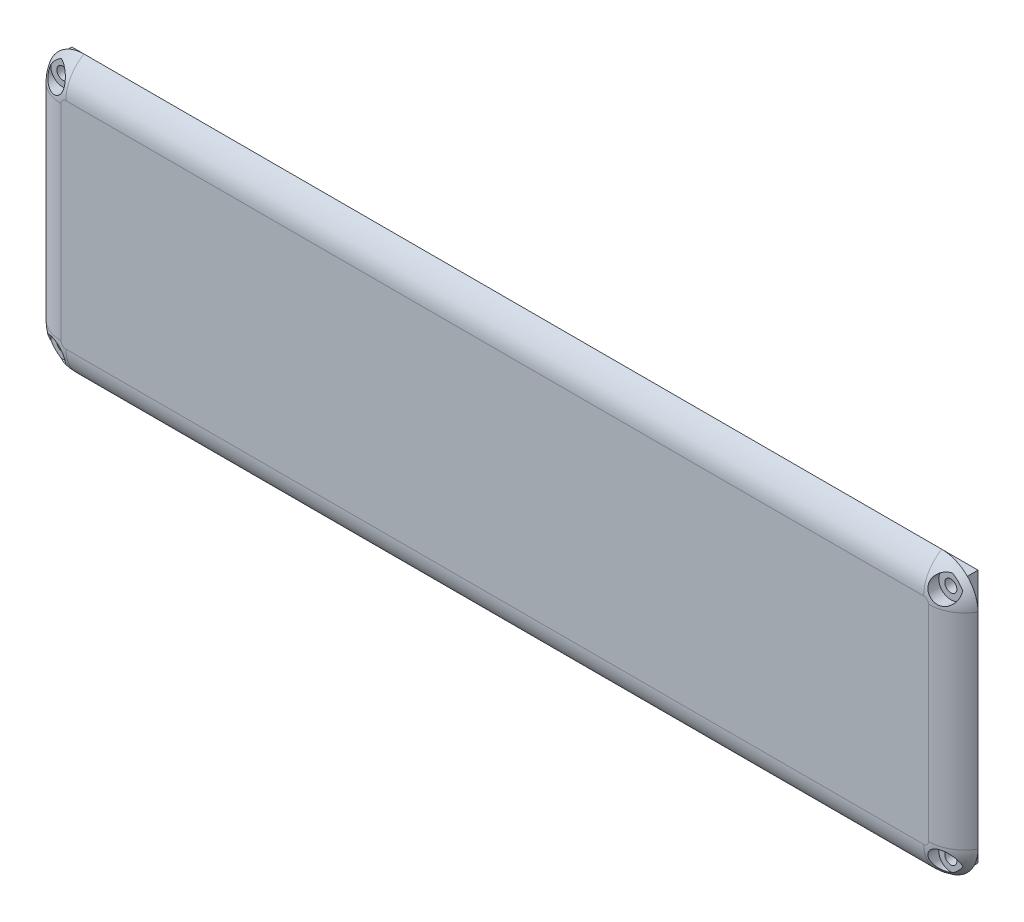
from build123d import *

# Parameters (mm, degrees)
SKETCH_1_W          = 150
SKETCH_1_H          = 42
EXTRUDE_1_DEPTH     = 2
SKETCH_2_R          = 1
CUT_EXTRUDE_1_DEPTH = 2
SKETCH_3_W          = 154
SKETCH_3_H          = 46
EXTRUDE_2_DEPTH     = 3
FILLET_2_R          = 6
FILLET_3_R          = 6
CUT_EXTRUDE_START   = 2
SKETCH_2_2_R        = 1
CUT_EXTRUDE_2_DEPTH = 2
SKETCH_4_R          = 2
CUT_EXTRUDE_3_DEPTH = 2


with BuildPart() as part:
    # 草图1 → 凸台-拉伸1 (new body)
    with BuildSketch(Plane.XY):
        with Locations((0.451807229, -22.248953788)):
            Rectangle(SKETCH_1_W, SKETCH_1_H)
    extrude(amount=EXTRUDE_1_DEPTH)

    # 草图2 → 切除-拉伸1 (cut)
    with BuildSketch(Plane.XY.offset(2)):
        with Locations((73.951807229, -41.748953788)):
            Circle(SKETCH_2_R)
        with Locations(Location((73.951807229, -2.748953788, 0), (0, 0, 180))):
            Circle(SKETCH_2_R)
        with Locations(Location((-73.048192771, -41.748953788, 0), (0, 0, 180))):
            Circle(SKETCH_2_R)
        with Locations((-73.048192771, -2.748953788)):
            Circle(SKETCH_2_R)
    extrude(amount=-CUT_EXTRUDE_1_DEPTH, mode=Mode.SUBTRACT)

    # 草图3 → 凸台-拉伸2 (add)
    with BuildSketch(Plane.XY.offset(2)):
        with Locations((0.451807229, -22.248953788)):
            Rectangle(SKETCH_3_W, SKETCH_3_H)
    extrude(amount=EXTRUDE_2_DEPTH)

    # 圆角2
    fillet_2_edges = [part.edges().sort_by_distance(p)[0] for p in [
        (-76.548192771, 0.751046212, 3.5),
        (-76.548192771, -45.248953788, 3.5),
        (77.451807229, -45.248953788, 3.5),
        (77.451807229, 0.751046212, 3.5),
    ]]
    fillet(fillet_2_edges, radius=FILLET_2_R)

    # 圆角3
    # the kernel refuses this fillet: 6 mm, written as the material it takes off along each edge
    with BuildSketch(Plane(origin=(71.451807229, -5.248953788, 5), x_dir=(0, 1, 0), z_dir=(-1, 0, 0))) as fillet_3_piece_1:
        with BuildLine():
            CenterArc((0.803847577, 6), FILLET_3_R, 270, 60)
            Line((0.803847577, 0), (0.803847577, -0.12))
            Line((0.803847577, -0.12), (6, -0.12))
            Line((6, -0.12), (6.12, 0))
            ThreePointArc((6.12, 0), (6.12, 1.5), (6.103923048, 2.94))
            Line((6.103923048, 2.94), (6, 3))
        make_face()
    revolve(axis=Axis((71.451807229, -5.248953788, 5), (0, 0, -1)), revolution_arc=90, mode=Mode.SUBTRACT)
    with BuildSketch(Plane(origin=(77.451807229, -5.248953788, 5), x_dir=(-1, 0, 0), z_dir=(0, -1, 0)), Plane(origin=(-76.548192771, -39.248953788, 5), x_dir=(1, 0, 0), z_dir=(0, 1, 0))) as fillet_3_piece_2:
        with BuildLine():
            CenterArc((5.196152423, 6), FILLET_3_R, 210, 60)
            Line((0, 3), (-0.103923048, 2.94))
            ThreePointArc((-0.103923048, 2.94), (-0.12, 1.5), (-0.12, 0))
            Line((-0.12, 0), (0, -0.12))
            Line((0, -0.12), (5.196152423, -0.12))
            Line((5.196152423, -0.12), (5.196152423, 0))
        make_face()
    extrude(amount=34, mode=Mode.SUBTRACT)
    with BuildSketch(Plane(origin=(71.451807229, -39.248953788, 5), x_dir=(1, 0, 0), z_dir=(0, 1, 0))) as fillet_3_piece_3:
        with BuildLine():
            CenterArc((0.803847577, 6), FILLET_3_R, 270, 60)
            Line((6, 3), (6.103923048, 2.94))
            ThreePointArc((6.103923048, 2.94), (6.12, 1.5), (6.12, 0))
            Line((6.12, 0), (6, -0.12))
            Line((6, -0.12), (0.803847577, -0.12))
            Line((0.803847577, -0.12), (0.803847577, 0))
        make_face()
    revolve(axis=Axis((71.451807229, -39.248953788, 5), (0, 0, -1)), revolution_arc=90, mode=Mode.SUBTRACT)
    with BuildSketch(Plane(origin=(71.451807229, -45.248953788, 5), x_dir=(0, 1, 0), z_dir=(-1, 0, 0))) as fillet_3_piece_4:
        with BuildLine():
            CenterArc((5.196152423, 6), FILLET_3_R, 210, 60)
            Line((0, 3), (-0.103923048, 2.94))
            ThreePointArc((-0.103923048, 2.94), (-0.12, 1.5), (-0.12, 0))
            Line((-0.12, 0), (0, -0.12))
            Line((0, -0.12), (5.196152423, -0.12))
            Line((5.196152423, -0.12), (5.196152423, 0))
        make_face()
    extrude(amount=142, mode=Mode.SUBTRACT)
    with BuildSketch(Plane(origin=(-70.548192771, -39.248953788, 5), x_dir=(-1, 0, 0), z_dir=(0, 1, 0))) as fillet_3_piece_5:
        with BuildLine():
            CenterArc((0.803847577, -6), FILLET_3_R, 30, 60)
            Line((6, -3), (6.103923048, -2.94))
            ThreePointArc((6.103923048, -2.94), (6.12, -1.5), (6.12, 0))
            Line((6.12, 0), (6, 0.12))
            Line((6, 0.12), (0.803847577, 0.12))
            Line((0.803847577, 0.12), (0.803847577, 0))
        make_face()
    revolve(axis=Axis((-70.548192771, -39.248953788, 5), (0, 0, 1)), revolution_arc=90, mode=Mode.SUBTRACT)
    with BuildSketch(Plane(origin=(-70.548192771, -5.248953788, 5), x_dir=(0, 1, 0), z_dir=(1, 0, 0))) as fillet_3_piece_6:
        with BuildLine():
            CenterArc((0.803847577, -6), FILLET_3_R, 30, 60)
            Line((0.803847577, 0), (0.803847577, 0.12))
            Line((0.803847577, 0.12), (6, 0.12))
            Line((6, 0.12), (6.12, 0))
            ThreePointArc((6.12, 0), (6.12, -1.5), (6.103923048, -2.94))
            Line((6.103923048, -2.94), (6, -3))
        make_face()
    revolve(axis=Axis((-70.548192771, -5.248953788, 5), (0, 0, 1)), revolution_arc=90, mode=Mode.SUBTRACT)
    with BuildSketch(Plane(origin=(-70.548192771, 0.751046212, 5), x_dir=(0, 0, -1), z_dir=(1, 0, 0))) as fillet_3_piece_7:
        with BuildLine():
            CenterArc((6, -5.196152423), FILLET_3_R, 120, 60)
            Line((0, -5.196152423), (-0.12, -5.196152423))
            Line((-0.12, -5.196152423), (-0.12, 0))
            Line((-0.12, 0), (0, 0.12))
            ThreePointArc((0, 0.12), (1.5, 0.12), (2.94, 0.103923048))
            Line((2.94, 0.103923048), (3, 0))
        make_face()
    extrude(amount=142, mode=Mode.SUBTRACT)

    # 草图2<2> → 切除-拉伸2 (cut)
    with BuildSketch(Plane.XY.offset(2).offset(CUT_EXTRUDE_START)):
        with Locations((73.951807229, -41.748953788)):
            Circle(SKETCH_2_2_R)
        with Locations(Location((73.951807229, -2.748953788, 0), (0, 0, 344.465859099))):
            Circle(SKETCH_2_2_R)
        with Locations(Location((-73.048192771, -41.748953788, 0), (0, 0, 285.534141265))):
            Circle(SKETCH_2_2_R)
        with Locations((-73.048192771, -2.748953788)):
            Circle(SKETCH_2_2_R)
    extrude(amount=-CUT_EXTRUDE_2_DEPTH, mode=Mode.SUBTRACT)

    # 草图4 → 切除-拉伸3 (cut)
    with BuildSketch(Plane.XY.offset(5)):
        with Locations((73.951807229, -2.748953788)):
            Circle(SKETCH_4_R)
        with Locations((73.951807229, -41.748953788)):
            Circle(SKETCH_4_R)
        with Locations((-73.048192771, -41.748953788)):
            Circle(SKETCH_4_R)
        with Locations((-73.048192771, -2.748953788)):
            Circle(SKETCH_4_R)
    extrude(amount=-CUT_EXTRUDE_3_DEPTH, mode=Mode.SUBTRACT)


solid = part.part
